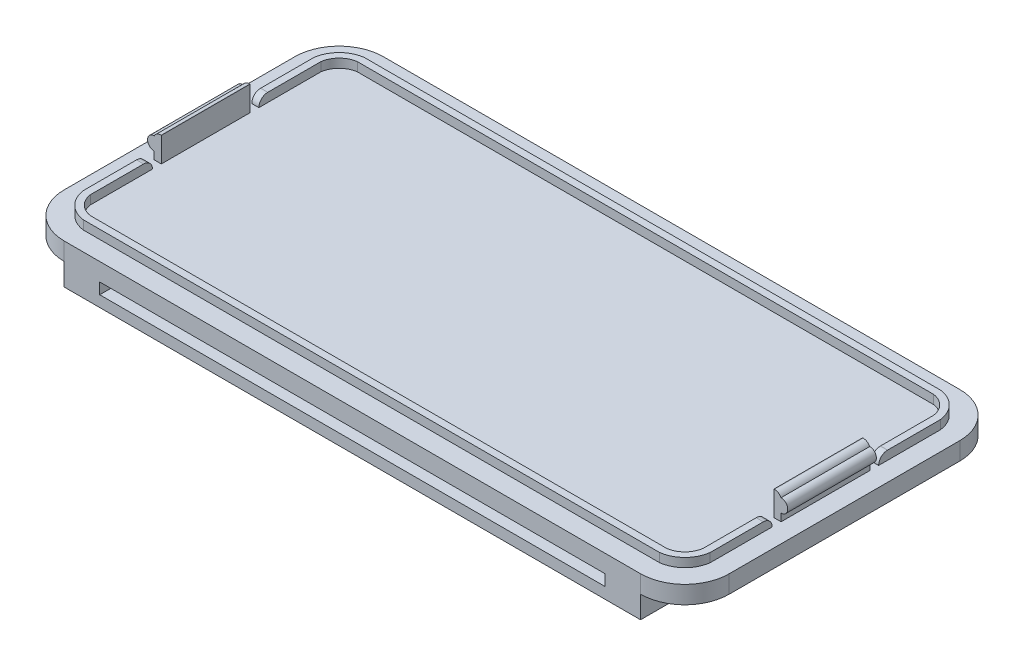
from build123d import *

# Parameters (mm, degrees)
EXTRUDE_2_DEPTH     = 2
EXTRUDE_4_DEPTH     = 1
SKETCH_7_W          = 0.8
SKETCH_7_H          = 10
EXTRUDE_8_DEPTH     = 2.8
SKETCH_8_R          = 0.75
EXTRUDE_9_DEPTH     = 10
FILLET_1_R          = 0.85
SKETCH_11_W         = 1
SKETCH_11_H         = 1
CUT_EXTRUDE_1_DEPTH = 1.2
FILLET_2_R          = 1
SKETCH3_W           = 1.794871795
SKETCH3_H           = 10.256410256
CUT_EXTRUDE1_DEPTH  = 1
SKETCH_13_W         = 0.8
SKETCH_13_H         = 10
EXTRUDE_10_DEPTH    = 1.8
SKETCH_14_R         = 0.75
EXTRUDE_11_DEPTH    = 10
FILLET_3_R          = 0.85
SKETCH_15_W         = 0.8
SKETCH_15_H         = 1
CUT_EXTRUDE_3_DEPTH = 1
FILLET_4_R          = 1
SKETCH5_W           = 4
SKETCH5_H           = 8
BOSS_EXTRUDE1_DEPTH = 2.5
BOSS_EXTRUDE2_REACH = 70.579
SKETCH7_W           = 8
SKETCH7_H           = 1.25


# Some blends are built 0.0001 mm under size
with BuildPart() as part:
    # case 2 → 凸台-拉伸2 (new body)
    with BuildSketch(Plane(origin=(0, 0, 0), x_dir=(1, 0, 0), z_dir=(0, 1, 0))):
        with BuildLine():
            Line((-34.042196447, 18), (30.957803553, 18))
            ThreePointArc((30.957803553, 18), (34.493337459, 16.535533906), (35.957803553, 13))
            Line((35.957803553, 13), (35.957803553, -13))
            ThreePointArc((35.957803553, -13), (34.493337459, -16.535533906), (30.957803553, -18))
            Line((30.957803553, -18), (-34.042196447, -18))
            ThreePointArc((-34.042196447, -18), (-37.577730353, -16.535533906), (-39.042196447, -13))
            Line((-39.042196447, -13), (-39.042196447, 13))
            ThreePointArc((-39.042196447, 13), (-37.577730353, 16.535533906), (-34.042196447, 18))
        make_face()
    extrude(amount=EXTRUDE_2_DEPTH)

    # 草图3 → 凸台-拉伸4 (add)
    with BuildSketch(Plane(origin=(0, 2, 0), x_dir=(1, 0, 0), z_dir=(0, 1, 0))):
        with BuildLine():
            Line((-36.892196447, 13), (-36.892196447, -13))
            ThreePointArc((-36.892196447, -13), (-35.952846076, -14.910649629), (-34.042196447, -15.85))
            Line((-34.042196447, -15.85), (30.957803553, -15.85))
            ThreePointArc((30.957803553, -15.85), (32.868453181, -14.910649629), (33.807803553, -13))
            Line((33.807803553, -13), (33.807803553, 13))
            ThreePointArc((33.807803553, 13), (32.868453181, 14.910649629), (30.957803553, 15.85))
            Line((30.957803553, 15.85), (-34.042196447, 15.85))
            ThreePointArc((-34.042196447, 15.85), (-35.952846076, 14.910649629), (-36.892196447, 13))
        make_face()
        with BuildLine():
            Line((-34.042196447, -15.05), (30.957803553, -15.05))
            ThreePointArc((30.957803553, -15.05), (32.327315928, -14.369512375), (33.007803553, -13))
            Line((33.007803553, -13), (33.007803553, 13))
            ThreePointArc((33.007803553, 13), (32.327315928, 14.369512375), (30.957803553, 15.05))
            Line((30.957803553, 15.05), (-34.042196447, 15.05))
            ThreePointArc((-34.042196447, 15.05), (-35.411708823, 14.369512375), (-36.092196447, 13))
            Line((-36.092196447, 13), (-36.092196447, -13))
            ThreePointArc((-36.092196447, -13), (-35.411708823, -14.369512375), (-34.042196447, -15.05))
        make_face(mode=Mode.SUBTRACT)
    extrude(amount=EXTRUDE_4_DEPTH)

    # 草图7 → 凸台-拉伸8 (add)
    with BuildSketch(Plane(origin=(0, 2, 0), x_dir=(1, 0, 0), z_dir=(0, 1, 0))):
        with Locations((-36.492196447, 0)):
            Rectangle(SKETCH_7_W, SKETCH_7_H)
    extrude(amount=EXTRUDE_8_DEPTH)

    # 草图8 → 凸台-拉伸9 (add)
    with BuildSketch(Plane.XY.offset(5)):
        with Locations((-36.892196447, 3.6)):
            Circle(SKETCH_8_R)
    extrude(amount=-EXTRUDE_9_DEPTH)

    # 圆角1
    # the kernel refuses this fillet: 0.85 mm, written as the material it takes off along each edge
    with BuildSketch(Plane(origin=(-36.892196447, 4.8, 6.875), x_dir=(0, -1, 0), z_dir=(0, 0, -1))) as fillet_1_piece_1:
        with BuildLine():
            CenterArc((0.85, -0.75), FILLET_1_R, 118.072486936, 61.927513064)
            Line((0, -0.75), (-0.017, -0.75))
            Line((-0.017, -0.75), (-0.017, 0))
            Line((-0.017, 0), (0, 0.017))
            ThreePointArc((0, 0.017), (0.225, 0.017), (0.442, 0.015))
            Line((0.442, 0.015), (0.45, 0))
        make_face()
    extrude(amount=13.75, mode=Mode.SUBTRACT)

    # 草图11 → 切除-拉伸1 (cut)
    with BuildSketch(Plane.ZY.offset(36.892196447)):
        with Locations((5.5, 2.5)):
            Rectangle(SKETCH_11_W, SKETCH_11_H)
        with Locations((-5.5, 2.5)):
            Rectangle(SKETCH_11_W, SKETCH_11_H)
    extrude(amount=-CUT_EXTRUDE_1_DEPTH, mode=Mode.SUBTRACT)

    # 圆角2
    fillet_2_edges = [part.edges().sort_by_distance(p)[0] for p in [
        (-36.492196447, 3, 6),
        (-36.492196447, 3, -6),
    ]]
    fillet(fillet_2_edges, radius=FILLET_2_R - 0.0001)  # a hair under: the kernel refuses the full size

    # Sketch3 → Cut-Extrude1 (cut)
    # profile 1 of 9: a face of its own
    with BuildSketch(Plane.XZ):
        with BuildLine():
            Line((-34.346153846, 5.5), (-32.342948718, 5.5))
            add(Edge.make_bspline(
                [(-32.342948718, 5.5), (-32.212061894, 5.499414123), (-31.959553774, 5.498283843), (-31.59541629, 5.484577693), (-31.259481633, 5.460015438), (-30.951826982, 5.429660375), (-30.672578836, 5.387103759), (-30.421387495, 5.33831593), (-30.198200829, 5.278878154), (-30.000502078, 5.208326339), (-29.823073834, 5.125148505), (-29.65516949, 5.036558175), (-29.500583701, 4.93082874), (-29.351514057, 4.81935527), (-29.216483126, 4.691488748), (-29.08706687, 4.555738875), (-28.96874642, 4.406721924), (-28.860973524, 4.246241705), (-28.7632069, 4.077263206), (-28.677791437, 3.899484343), (-28.608507197, 3.7126238), (-28.550386335, 3.517890353), (-28.503703092, 3.315292488), (-28.47262924, 3.10358421), (-28.451522316, 2.884243747), (-28.449659922, 2.73496049), (-28.448717949, 2.659455128)],
                knots=[0, 0, 0, 0, 1.698747864, 3.27724071, 4.728299578, 6.070144658, 7.288476769, 8.393259625, 9.389771311, 10.283485332, 11.113357557, 11.931608583, 12.74405601, 13.541433047, 14.344816069, 15.154114104, 15.974336324, 16.810834471, 17.661136416, 18.50621059, 19.367396281, 20.244825668, 21.142564693, 22.063065223, 23.020325768, 24, 24, 24, 24], degree=3))
            add(Edge.make_bspline(
                [(-28.448717949, 2.659455128), (-28.450080866, 2.575925345), (-28.452759164, 2.411779055), (-28.479015125, 2.171160733), (-28.523868602, 1.941752949), (-28.58248975, 1.721621064), (-28.664232772, 1.514386738), (-28.757620336, 1.315105294), (-28.872516661, 1.129363974), (-29.003804081, 0.954839376), (-29.147184921, 0.790112534), (-29.306063036, 0.639939624), (-29.477410142, 0.503296922), (-29.660234371, 0.378752402), (-29.8552221, 0.266557297), (-30.062232636, 0.165661021), (-30.282679565, 0.079290548), (-30.436192173, 0.03411949), (-30.514022436, 0.011217949)],
                knots=[0, 0, 0, 0, 1.102006807, 2.165578795, 3.188629044, 4.184801286, 5.166646146, 6.124351954, 7.085497154, 8.042432466, 9.003981491, 9.963833307, 10.922997304, 11.89326795, 12.880200226, 13.889073926, 14.929769137, 16, 16, 16, 16], degree=3))
            add(Edge.make_bspline(
                [(-30.514022436, 0.011217949), (-30.565285924, -0.00153649), (-30.676339148, -0.029166712), (-30.86010173, -0.057218322), (-31.071868812, -0.083010053), (-31.312325176, -0.105174923), (-31.581609449, -0.12024187), (-31.879460895, -0.132008485), (-32.206014495, -0.14056403), (-32.433086955, -0.140867618), (-32.551282051, -0.141025641)],
                knots=[0, 0, 0, 0, 0.618981996, 1.340914327, 2.176866532, 3.120127938, 4.170906482, 5.338178032, 6.614476169, 8, 8, 8, 8], degree=3))
            Line((-32.551282051, -0.141025641), (-32.551282051, -4.5))
            Line((-32.551282051, -4.5), (-34.346153846, -4.5))
            Line((-34.346153846, -4.5), (-34.346153846, 5.5))
        make_face()
        with BuildLine():
            Line((-32.551282051, 1.653846154), (-31.916266026, 1.653846154))
            add(Edge.make_bspline(
                [(-31.916266026, 1.653846154), (-31.800714834, 1.654578838), (-31.588098926, 1.655926988), (-31.297740676, 1.675422019), (-31.064403201, 1.705194869), (-30.880062263, 1.747896022), (-30.734507633, 1.812700675), (-30.608975876, 1.887667455), (-30.501304084, 1.982460891), (-30.40807616, 2.090778611), (-30.333543244, 2.215241101), (-30.281858549, 2.353821729), (-30.248285187, 2.50360877), (-30.245184375, 2.607850636), (-30.243589744, 2.661458333)],
                knots=[0, 0, 0, 0, 1.8619151, 3.425951444, 4.686033666, 5.651700536, 6.461346321, 7.243864085, 7.999046032, 8.762387399, 9.539336099, 10.322741239, 11.137448474, 12, 12, 12, 12], degree=3))
            add(Edge.make_bspline(
                [(-30.243589744, 2.661458333), (-30.245167972, 2.708294681), (-30.248230115, 2.799168456), (-30.270725453, 2.930321853), (-30.306576549, 3.052583875), (-30.35852341, 3.164677657), (-30.425678401, 3.266412733), (-30.507553924, 3.357749027), (-30.603099357, 3.440642582), (-30.676866017, 3.484519408), (-30.714342949, 3.506810897)],
                knots=[0, 0, 0, 0, 1.102301479, 2.1387299, 3.123554645, 4.094223062, 5.036071848, 5.982632524, 6.975082478, 8, 8, 8, 8], degree=3))
            add(Edge.make_bspline(
                [(-30.714342949, 3.506810897), (-30.746088073, 3.522865317), (-30.813299006, 3.556855813), (-30.927765742, 3.59637225), (-31.059858607, 3.629708718), (-31.210469377, 3.657377665), (-31.378997222, 3.678851641), (-31.565412075, 3.69527386), (-31.769988262, 3.701877875), (-31.912258759, 3.704014878), (-31.986378205, 3.705128205)],
                knots=[0, 0, 0, 0, 0.656809284, 1.390599849, 2.23162475, 3.173112763, 4.218524733, 5.370385145, 6.63003504, 8, 8, 8, 8], degree=3))
            Line((-31.986378205, 3.705128205), (-32.551282051, 3.705128205))
            Line((-32.551282051, 3.705128205), (-32.551282051, 1.653846154))
        make_face(mode=Mode.SUBTRACT)
    # profile 2 of 9: a face of its own
    with BuildSketch(Plane.XZ):
        with BuildLine():
            Line((-19.608573718, -1.294871795), (-25.371794872, -1.294871795))
            add(Edge.make_bspline(
                [(-25.371794872, -1.294871795), (-25.360044129, -1.361837155), (-25.336952993, -1.493429371), (-25.28680977, -1.684578484), (-25.222819497, -1.864714181), (-25.146131184, -2.03407726), (-25.058037797, -2.193563078), (-24.955284158, -2.342423583), (-24.839173605, -2.480527291), (-24.710377458, -2.60727399), (-24.571042515, -2.72084178), (-24.421844499, -2.820334343), (-24.262629446, -2.901912158), (-24.095222698, -2.970673791), (-23.91837334, -3.025139971), (-23.731821096, -3.062704259), (-23.536060486, -3.084893621), (-23.402702378, -3.088103059), (-23.334535256, -3.08974359)],
                knots=[0, 0, 0, 0, 1.091296461, 2.144483647, 3.168565212, 4.157007626, 5.126487748, 6.090021542, 7.05641414, 8.019231907, 8.98705074, 9.938580405, 10.892824166, 11.854447369, 12.841318655, 13.858982407, 14.905600794, 16, 16, 16, 16], degree=3))
            add(Edge.make_bspline(
                [(-23.334535256, -3.08974359), (-23.252252913, -3.087571256), (-23.090214747, -3.083293292), (-22.852827627, -3.045354104), (-22.623239702, -2.988048629), (-22.403623683, -2.902830576), (-22.191435664, -2.796749081), (-21.99016891, -2.664584591), (-21.796339653, -2.510199384), (-21.678080964, -2.391199325), (-21.617788462, -2.330528846)],
                knots=[0, 0, 0, 0, 1.021034703, 2.010718019, 2.977989445, 3.954245119, 4.929443971, 5.918328161, 6.938689359, 8, 8, 8, 8], degree=3))
            Line((-21.617788462, -2.330528846), (-20.115384615, -3.045673077))
            add(Edge.make_bspline(
                [(-20.115384615, -3.045673077), (-20.162686924, -3.111037607), (-20.256414708, -3.24055502), (-20.40942217, -3.42281947), (-20.5690952, -3.592879596), (-20.735552881, -3.749616887), (-20.909006324, -3.892584703), (-21.088973023, -4.02352465), (-21.278083117, -4.138921045), (-21.472555384, -4.244356693), (-21.676409927, -4.334746186), (-21.889082589, -4.411827154), (-22.109672582, -4.481507694), (-22.340965482, -4.534600448), (-22.581035315, -4.576628239), (-22.830456374, -4.606473539), (-23.089195787, -4.62490755), (-23.265059458, -4.62709288), (-23.354567308, -4.628205128)],
                knots=[0, 0, 0, 0, 1.028154879, 2.037251081, 3.030720504, 4.000128189, 4.949298328, 5.894184978, 6.834267904, 7.770992897, 8.712077017, 9.673380525, 10.653304757, 11.658697181, 12.695551717, 13.758623199, 14.859225354, 16, 16, 16, 16], degree=3))
            add(Edge.make_bspline(
                [(-23.354567308, -4.628205128), (-23.492273665, -4.62539771), (-23.761963628, -4.619899543), (-24.156433952, -4.568868685), (-24.531071349, -4.484254021), (-24.886933665, -4.369233381), (-25.222482625, -4.217370103), (-25.537884295, -4.031628717), (-25.836289987, -3.815570256), (-26.108581741, -3.564660229), (-26.356647563, -3.291559581), (-26.574533157, -2.998268135), (-26.75685672, -2.686835006), (-26.906584497, -2.359321324), (-27.022958126, -2.014888783), (-27.106856762, -1.653387079), (-27.158287632, -1.274988873), (-27.163842421, -1.017257454), (-27.166666667, -0.886217949)],
                knots=[0, 0, 0, 0, 1.103565453, 2.161269334, 3.182010356, 4.179077853, 5.15417608, 6.128274628, 7.109042802, 8.101804412, 9.090965879, 10.063106201, 11.02526161, 11.978650795, 12.945248442, 13.93468508, 14.949922959, 16, 16, 16, 16], degree=3))
            add(Edge.make_bspline(
                [(-27.166666667, -0.886217949), (-27.163814625, -0.751848561), (-27.15820336, -0.487482826), (-27.107299582, -0.100347232), (-27.022726175, 0.269032487), (-26.906012127, 0.621165006), (-26.75855574, 0.957151645), (-26.573912422, 1.274052922), (-26.356755688, 1.572972117), (-26.109583518, 1.852510854), (-25.836138252, 2.104825104), (-25.545576822, 2.329687524), (-25.234634472, 2.517057818), (-24.90682823, 2.668452899), (-24.564254861, 2.791457581), (-24.202954696, 2.873306924), (-23.82567668, 2.928263858), (-23.567777735, 2.933325049), (-23.436698718, 2.935897436)],
                knots=[0, 0, 0, 0, 1.079208495, 2.12329425, 3.130605359, 4.119693003, 5.099659317, 6.073216462, 7.060498243, 8.06384408, 9.066070512, 10.045757761, 11.010926815, 11.975797609, 12.942977511, 13.929384301, 14.947594487, 16, 16, 16, 16], degree=3))
            add(Edge.make_bspline(
                [(-23.436698718, 2.935897436), (-23.298332654, 2.933046463), (-23.026665148, 2.92744887), (-22.62944746, 2.876832371), (-22.252322515, 2.791701737), (-21.893683551, 2.677675659), (-21.558110534, 2.521976156), (-21.238229907, 2.34080557), (-20.941714222, 2.120076842), (-20.665402937, 1.870394688), (-20.415975531, 1.593380991), (-20.197948342, 1.292459272), (-20.012434038, 0.970566352), (-19.862072854, 0.626396885), (-19.745818719, 0.260984102), (-19.661842419, -0.125197436), (-19.610803845, -0.533616578), (-19.605352417, -0.813284573), (-19.602564103, -0.956330128)],
                knots=[0, 0, 0, 0, 1.080001299, 2.120471247, 3.119684163, 4.095710327, 5.052285597, 6.002875087, 6.961153713, 7.931888285, 8.906493152, 9.865905668, 10.82813294, 11.801621613, 12.7925306, 13.817193356, 14.883530496, 16, 16, 16, 16], degree=3))
            Line((-19.602564103, -0.956330128), (-19.608573718, -1.294871795))
        make_face()
        with BuildLine():
            add(Edge.make_bspline(
                [(-21.397435897, 0.115384615), (-21.431306226, 0.206786912), (-21.498649262, 0.388518488), (-21.650774379, 0.639263719), (-21.852639541, 0.856419274), (-22.087423207, 1.048668808), (-22.355678245, 1.204710539), (-22.648951472, 1.31768982), (-22.963535969, 1.385433614), (-23.179953151, 1.393378771), (-23.290464744, 1.397435897)],
                knots=[0, 0, 0, 0, 0.954238005, 1.897273737, 2.851915805, 3.847685534, 4.862635127, 5.880135777, 6.917509367, 8, 8, 8, 8], degree=3))
            add(Edge.make_bspline(
                [(-23.290464744, 1.397435897), (-23.411161396, 1.393538533), (-23.64709822, 1.385919998), (-23.987421025, 1.304894075), (-24.308439011, 1.183965305), (-24.497693022, 1.059285175), (-24.592548077, 0.996794872)],
                knots=[0, 0, 0, 0, 1.044195649, 2.041185066, 3.018232172, 4, 4, 4, 4], degree=3))
            add(Edge.make_bspline(
                [(-24.592548077, 0.996794872), (-24.651730547, 0.949200888), (-24.777904548, 0.847732947), (-24.941767086, 0.645314038), (-25.10317305, 0.40023018), (-25.19494124, 0.214071675), (-25.243589744, 0.115384615)],
                knots=[0, 0, 0, 0, 0.82159062, 1.751589201, 2.808063854, 4, 4, 4, 4], degree=3))
            Line((-25.243589744, 0.115384615), (-21.397435897, 0.115384615))
        make_face(mode=Mode.SUBTRACT)
    # profile 3 of 9: a face of its own
    with BuildSketch(Plane.XZ):
        with BuildLine():
            Line((-12.551282051, 2.807692308), (-10.756410256, 2.807692308))
            Line((-10.756410256, 2.807692308), (-10.756410256, -4.5))
            Line((-10.756410256, -4.5), (-12.551282051, -4.5))
            Line((-12.551282051, -4.5), (-12.551282051, -3.702724359))
            add(Edge.make_bspline(
                [(-12.551282051, -3.702724359), (-12.640217287, -3.780330319), (-12.812823018, -3.930948161), (-13.084793797, -4.12637864), (-13.357559306, -4.287583528), (-13.632430191, -4.41597443), (-13.913631102, -4.510777897), (-14.203186573, -4.579417821), (-14.50526651, -4.619896463), (-14.71061629, -4.625406724), (-14.814903846, -4.628205128)],
                knots=[0, 0, 0, 0, 1.129196829, 2.191548051, 3.199897424, 4.157751732, 5.089409408, 6.034969131, 7.002052659, 8, 8, 8, 8], degree=3))
            add(Edge.make_bspline(
                [(-14.814903846, -4.628205128), (-14.931971264, -4.625571477), (-15.163303116, -4.620367234), (-15.502756926, -4.565584179), (-15.830533327, -4.481726502), (-16.146366257, -4.363057407), (-16.449681084, -4.209285525), (-16.742799088, -4.024422978), (-17.020695333, -3.801979986), (-17.28568321, -3.55158109), (-17.528304521, -3.276140523), (-17.740406361, -2.979481362), (-17.919192449, -2.665811062), (-18.065662324, -2.336169585), (-18.180879796, -1.990798869), (-18.263013366, -1.628603503), (-18.311472267, -1.24945413), (-18.317470113, -0.991192425), (-18.320512821, -0.860176282)],
                knots=[0, 0, 0, 0, 0.980476535, 1.937477201, 2.874147792, 3.812856188, 4.758993464, 5.720109578, 6.712210464, 7.737600662, 8.772720504, 9.783789959, 10.789002326, 11.793715968, 12.802552247, 13.835794126, 14.902098527, 16, 16, 16, 16], degree=3))
            add(Edge.make_bspline(
                [(-18.320512821, -0.860176282), (-18.317319488, -0.724508894), (-18.311055411, -0.458382195), (-18.265234059, -0.067853919), (-18.184616162, 0.303322052), (-18.074687865, 0.655659847), (-17.933284198, 0.989220339), (-17.761063981, 1.304550006), (-17.555684317, 1.600824627), (-17.319020664, 1.8730014), (-17.063482045, 2.122464558), (-16.790100899, 2.339642021), (-16.503152308, 2.524144381), (-16.202331338, 2.674769906), (-15.88768095, 2.791165689), (-15.560443377, 2.87626051), (-15.219165916, 2.927320392), (-14.986684944, 2.933014678), (-14.868990385, 2.935897436)],
                knots=[0, 0, 0, 0, 1.136281865, 2.228943489, 3.287578264, 4.313574083, 5.316051562, 6.317280042, 7.318008486, 8.329309503, 9.333984563, 10.305318864, 11.248632312, 12.186624717, 13.117503092, 14.05354244, 15.014596925, 16, 16, 16, 16], degree=3))
            add(Edge.make_bspline(
                [(-14.868990385, 2.935897436), (-14.759967087, 2.933632454), (-14.544249279, 2.929150872), (-14.227175182, 2.880489461), (-13.919659039, 2.806892533), (-13.623378367, 2.702030158), (-13.335902973, 2.569620077), (-13.062177614, 2.403700375), (-12.796214302, 2.211244585), (-12.633934865, 2.060932535), (-12.551282051, 1.984375)],
                knots=[0, 0, 0, 0, 1.017011718, 2.012299608, 2.98747302, 3.965332399, 4.941441765, 5.936729654, 6.94912688, 8, 8, 8, 8], degree=3))
            Line((-12.551282051, 1.984375), (-12.551282051, 2.807692308))
        make_face()
        with BuildLine():
            add(Edge.make_bspline(
                [(-14.492387821, 1.269230769), (-14.563908171, 1.267036278), (-14.704083387, 1.262735219), (-14.910230225, 1.236864046), (-15.107244762, 1.191277886), (-15.293721904, 1.123934125), (-15.472440845, 1.041899611), (-15.640687712, 0.939152733), (-15.799851096, 0.817708107), (-15.94899494, 0.680505905), (-16.084961529, 0.5296956), (-16.202172664, 0.365128882), (-16.301783193, 0.191239889), (-16.386027812, 0.007505796), (-16.446327845, -0.188247538), (-16.494085447, -0.393471754), (-16.518868551, -0.609843428), (-16.523360946, -0.757294026), (-16.525641026, -0.83213141)],
                knots=[0, 0, 0, 0, 1.04836806, 2.054732945, 3.03993516, 4.00574415, 4.955904794, 5.917688631, 6.888591924, 7.88601754, 8.884115178, 9.859153345, 10.841239365, 11.818093293, 12.814750328, 13.83810466, 14.90274714, 16, 16, 16, 16], degree=3))
            add(Edge.make_bspline(
                [(-16.525641026, -0.83213141), (-16.523395775, -0.907647613), (-16.518971534, -1.056451413), (-16.493684728, -1.27464826), (-16.447645642, -1.482870319), (-16.380476352, -1.679434257), (-16.298447068, -1.866992373), (-16.198598981, -2.044679067), (-16.075953096, -2.209352616), (-15.939867317, -2.364909751), (-15.787663811, -2.503816234), (-15.627599816, -2.627152439), (-15.457488986, -2.730347762), (-15.279176903, -2.813750875), (-15.093263774, -2.881717402), (-14.897418811, -2.926730636), (-14.693560564, -2.955506745), (-14.554585013, -2.959514006), (-14.484375, -2.961538462)],
                knots=[0, 0, 0, 0, 1.099136573, 2.165835871, 3.191374663, 4.196217796, 5.183857741, 6.167377911, 7.154730987, 8.166690795, 9.170734848, 10.148332609, 11.103258353, 12.059567475, 13.009337315, 13.978056681, 14.978520572, 16, 16, 16, 16], degree=3))
            add(Edge.make_bspline(
                [(-14.484375, -2.961538462), (-14.4115225, -2.959331668), (-14.268691995, -2.955005152), (-14.059181975, -2.929370081), (-13.859520827, -2.883616776), (-13.670539249, -2.815887456), (-13.489350726, -2.734441788), (-13.317590322, -2.633702663), (-13.157121897, -2.512536719), (-13.007132751, -2.374094205), (-12.869696613, -2.222052443), (-12.75086454, -2.055327693), (-12.647357458, -1.879252272), (-12.565953899, -1.689663113), (-12.501308058, -1.489877143), (-12.454926159, -1.278654447), (-12.429697094, -1.055767301), (-12.425311548, -0.903638139), (-12.423076923, -0.826121795)],
                knots=[0, 0, 0, 0, 1.050008698, 2.058587853, 3.036635738, 3.995319155, 4.947022481, 5.895997462, 6.858296291, 7.838991643, 8.833936038, 9.806048392, 10.784806122, 11.771666913, 12.772873988, 13.80724452, 14.882696879, 16, 16, 16, 16], degree=3))
            add(Edge.make_bspline(
                [(-12.423076923, -0.826121795), (-12.42528378, -0.749938696), (-12.429594413, -0.601130972), (-12.455034965, -0.382897604), (-12.50174615, -0.175822357), (-12.565061473, 0.020475401), (-12.647913225, 0.205546837), (-12.751498624, 0.37733995), (-12.869027177, 0.541806728), (-13.007984932, 0.689741001), (-13.157161552, 0.827181084), (-13.319989926, 0.944682882), (-13.491340075, 1.045949192), (-13.672264778, 1.129092738), (-13.864439315, 1.190040109), (-14.064441671, 1.237229428), (-14.275392296, 1.262719691), (-14.418875606, 1.267024992), (-14.492387821, 1.269230769)],
                knots=[0, 0, 0, 0, 1.106611376, 2.161533483, 3.185006901, 4.184773755, 5.152708835, 6.122342771, 7.094156588, 8.082475533, 9.064254463, 10.03606828, 10.992420271, 11.951521816, 12.920622147, 13.915721683, 14.932141191, 16, 16, 16, 16], degree=3))
        make_face(mode=Mode.SUBTRACT)
    # profile 4 of 9: a face of its own
    with BuildSketch(Plane.XZ):
        Polygon((-8.961538462, 5.756410256), (-7.166666667, 5.756410256), (-7.166666667, -0.225160256), (-4.374198718, 2.807692308), (-2.156650641, 2.807692308), (-5.363782051, -0.67588141), (-1.697916667, -4.5), (-3.957532051, -4.5), (-7.166666667, -1.152644231), (-7.166666667, -4.5), (-8.961538462, -4.5), align=None)
    # profile 5 of 9: a face of its own
    with BuildSketch(Plane.XZ):
        with BuildLine():
            Line((-0.628205128, 5.5), (1.375, 5.5))
            add(Edge.make_bspline(
                [(1.375, 5.5), (1.505886824, 5.499414123), (1.758394944, 5.498283843), (2.122532428, 5.484577693), (2.458467085, 5.460015438), (2.766121736, 5.429660375), (3.045369882, 5.387103759), (3.296561223, 5.33831593), (3.519747889, 5.278878154), (3.71744664, 5.208326339), (3.894874884, 5.125148505), (4.062779228, 5.036558175), (4.217365017, 4.93082874), (4.366434661, 4.81935527), (4.501465592, 4.691488748), (4.630881848, 4.555738875), (4.749202298, 4.406721924), (4.856975194, 4.246241705), (4.954741818, 4.077263206), (5.04015728, 3.899484343), (5.10944152, 3.7126238), (5.167562383, 3.517890353), (5.214245625, 3.315292488), (5.245319478, 3.10358421), (5.266426402, 2.884243747), (5.268288796, 2.73496049), (5.269230769, 2.659455128)],
                knots=[0, 0, 0, 0, 1.698747864, 3.27724071, 4.728299578, 6.070144658, 7.288476769, 8.393259625, 9.389771311, 10.283485332, 11.113357557, 11.931608583, 12.74405601, 13.541433047, 14.344816069, 15.154114104, 15.974336324, 16.810834471, 17.661136416, 18.50621059, 19.367396281, 20.244825668, 21.142564693, 22.063065223, 23.020325768, 24, 24, 24, 24], degree=3))
            add(Edge.make_bspline(
                [(5.269230769, 2.659455128), (5.267867852, 2.575925345), (5.265189553, 2.411779055), (5.238933593, 2.171160733), (5.194080116, 1.941752949), (5.135458968, 1.721621064), (5.053715946, 1.514386738), (4.960328382, 1.315105294), (4.845432057, 1.129363974), (4.714144637, 0.954839376), (4.570763797, 0.790112534), (4.411885682, 0.639939624), (4.240538576, 0.503296922), (4.057714347, 0.378752402), (3.862726618, 0.266557297), (3.655716082, 0.165661021), (3.435269153, 0.079290548), (3.281756545, 0.03411949), (3.203926282, 0.011217949)],
                knots=[0, 0, 0, 0, 1.102006807, 2.165578795, 3.188629044, 4.184801286, 5.166646146, 6.124351954, 7.085497154, 8.042432466, 9.003981491, 9.963833307, 10.922997304, 11.89326795, 12.880200226, 13.889073926, 14.929769137, 16, 16, 16, 16], degree=3))
            add(Edge.make_bspline(
                [(3.203926282, 0.011217949), (3.152662794, -0.00153649), (3.04160957, -0.029166712), (2.857846988, -0.057218322), (2.646079906, -0.083010053), (2.405623542, -0.105174923), (2.136339269, -0.12024187), (1.838487823, -0.132008485), (1.511934223, -0.14056403), (1.284861763, -0.140867618), (1.166666667, -0.141025641)],
                knots=[0, 0, 0, 0, 0.618981996, 1.340914327, 2.176866532, 3.120127938, 4.170906482, 5.338178032, 6.614476169, 8, 8, 8, 8], degree=3))
            Line((1.166666667, -0.141025641), (1.166666667, -4.5))
            Line((1.166666667, -4.5), (-0.628205128, -4.5))
            Line((-0.628205128, -4.5), (-0.628205128, 5.5))
        make_face()
        with BuildLine():
            Line((1.166666667, 1.653846154), (1.801682692, 1.653846154))
            add(Edge.make_bspline(
                [(1.801682692, 1.653846154), (1.917233884, 1.654578838), (2.129849792, 1.655926988), (2.420208042, 1.675422019), (2.653545517, 1.705194869), (2.837886455, 1.747896022), (2.983441085, 1.812700675), (3.108972842, 1.887667455), (3.216644634, 1.982460891), (3.309872558, 2.090778611), (3.384405474, 2.215241101), (3.436090169, 2.353821729), (3.469663531, 2.50360877), (3.472764343, 2.607850636), (3.474358974, 2.661458333)],
                knots=[0, 0, 0, 0, 1.8619151, 3.425951444, 4.686033666, 5.651700536, 6.461346321, 7.243864085, 7.999046032, 8.762387399, 9.539336099, 10.322741239, 11.137448474, 12, 12, 12, 12], degree=3))
            add(Edge.make_bspline(
                [(3.474358974, 2.661458333), (3.472780746, 2.708294681), (3.469718603, 2.799168456), (3.447223265, 2.930321853), (3.411372169, 3.052583875), (3.359425308, 3.164677657), (3.292270317, 3.266412733), (3.210394794, 3.357749027), (3.114849361, 3.440642582), (3.041082701, 3.484519408), (3.003605769, 3.506810897)],
                knots=[0, 0, 0, 0, 1.102301479, 2.1387299, 3.123554645, 4.094223062, 5.036071848, 5.982632524, 6.975082478, 8, 8, 8, 8], degree=3))
            add(Edge.make_bspline(
                [(3.003605769, 3.506810897), (2.971860645, 3.522865317), (2.904649712, 3.556855813), (2.790182976, 3.59637225), (2.658090111, 3.629708718), (2.507479341, 3.657377665), (2.338951496, 3.678851641), (2.152536643, 3.69527386), (1.947960456, 3.701877875), (1.805689959, 3.704014878), (1.731570513, 3.705128205)],
                knots=[0, 0, 0, 0, 0.656809284, 1.390599849, 2.23162475, 3.173112763, 4.218524733, 5.370385145, 6.63003504, 8, 8, 8, 8], degree=3))
            Line((1.731570513, 3.705128205), (1.166666667, 3.705128205))
            Line((1.166666667, 3.705128205), (1.166666667, 1.653846154))
        make_face(mode=Mode.SUBTRACT)
    # profile 6 of 9: a face of its own
    with BuildSketch(Plane.XZ):
        with BuildLine():
            Line((6.807692308, 2.807692308), (8.602564103, 2.807692308))
            Line((8.602564103, 2.807692308), (8.602564103, -0.699919872))
            add(Edge.make_bspline(
                [(8.602564103, -0.699919872), (8.602723488, -0.782059682), (8.603029388, -0.939706038), (8.611541581, -1.166117068), (8.62348587, -1.373159588), (8.638391535, -1.561077737), (8.660639195, -1.729419511), (8.686323181, -1.877863541), (8.715440535, -2.007479383), (8.76278903, -2.15195352), (8.836866605, -2.310052677), (8.948736856, -2.477893498), (9.084244359, -2.623026732), (9.241558317, -2.746740361), (9.422285292, -2.844229418), (9.623935339, -2.910296264), (9.843971289, -2.954700053), (9.997226, -2.959198917), (10.076923077, -2.961538462)],
                knots=[0, 0, 0, 0, 1.267339619, 2.432334223, 3.495366327, 4.467371443, 5.340232306, 6.114347373, 6.791623365, 7.387877112, 8.457231658, 9.474542289, 10.487879852, 11.508108106, 12.54995813, 13.638205937, 14.771795776, 16, 16, 16, 16], degree=3))
            add(Edge.make_bspline(
                [(10.076923077, -2.961538462), (10.15654943, -2.958868202), (10.310200482, -2.953715534), (10.531700417, -2.913533658), (10.733825429, -2.844680674), (10.91865147, -2.751289728), (11.08072801, -2.626301853), (11.221841424, -2.477369934), (11.340655608, -2.302091514), (11.397751302, -2.171338836), (11.427083333, -2.104166667)],
                knots=[0, 0, 0, 0, 1.116871431, 2.155171802, 3.144773418, 4.104381479, 5.046960687, 6.001340237, 6.973219418, 8, 8, 8, 8], degree=3))
            add(Edge.make_bspline(
                [(11.427083333, -2.104166667), (11.437847203, -2.074328187), (11.461607205, -2.008463184), (11.482754076, -1.89483699), (11.505514407, -1.760833291), (11.523518637, -1.603721206), (11.533706066, -1.424473744), (11.544620853, -1.222864992), (11.550183224, -0.99909574), (11.55090456, -0.842149572), (11.551282051, -0.760016026)],
                knots=[0, 0, 0, 0, 0.56094539, 1.238222264, 2.041156151, 2.969685991, 4.036367568, 5.220421584, 6.545382566, 8, 8, 8, 8], degree=3))
            Line((11.551282051, -0.760016026), (11.551282051, 2.807692308))
            Line((11.551282051, 2.807692308), (13.346153846, 2.807692308))
            Line((13.346153846, 2.807692308), (13.346153846, -0.263221154))
            add(Edge.make_bspline(
                [(13.346153846, -0.263221154), (13.345843066, -0.415483556), (13.345247206, -0.707416665), (13.328170227, -1.126185223), (13.304602061, -1.506929426), (13.274250797, -1.850697582), (13.230518376, -2.157632359), (13.176834499, -2.427013985), (13.117442991, -2.66062257), (13.062978765, -2.799037271), (13.037660256, -2.86338141)],
                knots=[0, 0, 0, 0, 1.388070971, 2.661352173, 3.82033814, 4.865898334, 5.806910977, 6.645039373, 7.370126333, 8, 8, 8, 8], degree=3))
            add(Edge.make_bspline(
                [(13.037660256, -2.86338141), (13.00520845, -2.932635584), (12.941151372, -3.069337373), (12.830000433, -3.263697042), (12.710173496, -3.447837431), (12.575969148, -3.617424055), (12.430126916, -3.77418049), (12.276769302, -3.921670191), (12.108989876, -4.053887155), (11.931139777, -4.174233696), (11.740737356, -4.281064307), (11.539086728, -4.375734322), (11.324008739, -4.452779482), (11.097368369, -4.518086121), (10.858120955, -4.566788641), (10.606748434, -4.603677085), (10.342975108, -4.622741173), (10.163086586, -4.626353967), (10.070913462, -4.628205128)],
                knots=[0, 0, 0, 0, 0.997311338, 1.968606903, 2.91805772, 3.860812155, 4.785445165, 5.709667791, 6.633356648, 7.568312411, 8.508286151, 9.478643871, 10.470653671, 11.485274776, 12.552984541, 13.653035246, 14.797438149, 16, 16, 16, 16], degree=3))
            add(Edge.make_bspline(
                [(10.070913462, -4.628205128), (9.971340586, -4.627018482), (9.776510234, -4.624696619), (9.491865812, -4.596262887), (9.22059585, -4.559473336), (8.965729062, -4.496924355), (8.723706114, -4.424458232), (8.497305566, -4.331972183), (8.28560229, -4.223234794), (8.088179729, -4.098890722), (7.906569021, -3.957800483), (7.736731851, -3.806062844), (7.58415129, -3.637640644), (7.443846205, -3.457734827), (7.317382479, -3.264689631), (7.204697345, -3.059191468), (7.105695351, -2.840305627), (7.052872876, -2.686897906), (7.026041667, -2.608974359)],
                knots=[0, 0, 0, 0, 1.211240017, 2.369985978, 3.478996442, 4.539426614, 5.559871561, 6.551301256, 7.510778031, 8.453136967, 9.386094087, 10.30661716, 11.221130616, 12.147659962, 13.080758632, 14.026335491, 14.997475882, 16, 16, 16, 16], degree=3))
            add(Edge.make_bspline(
                [(7.026041667, -2.608974359), (7.007736541, -2.548455949), (6.968303033, -2.418085187), (6.925726927, -2.201424197), (6.891673008, -1.951710275), (6.858546433, -1.668697792), (6.835436729, -1.351912277), (6.820331952, -1.001856828), (6.810126121, -0.617846912), (6.808527479, -0.350701513), (6.807692308, -0.211137821)],
                knots=[0, 0, 0, 0, 0.627914866, 1.352675004, 2.190563461, 3.132055958, 4.183353232, 5.345633452, 6.613289997, 8, 8, 8, 8], degree=3))
            Line((6.807692308, -0.211137821), (6.807692308, 2.807692308))
        make_face()
    # profile 7 of 9: a face of its own
    with BuildSketch(Plane.XZ):
        with Locations((15.910256411, 0.628205128)):
            Rectangle(SKETCH3_W, SKETCH3_H)
    # profile 8 of 9: a face of its own
    with BuildSketch(Plane.XZ):
        with BuildLine():
            Line((22.961538462, 1.679887821), (21.863782051, 0.5))
            add(Edge.make_bspline(
                [(21.863782051, 0.5), (21.808965815, 0.560657138), (21.704123119, 0.676671265), (21.543619085, 0.834824449), (21.385505268, 0.966519333), (21.232728109, 1.077148523), (21.082167351, 1.161987888), (20.935074493, 1.223027911), (20.79137896, 1.261777025), (20.696131487, 1.266792952), (20.649839744, 1.269230769)],
                knots=[0, 0, 0, 0, 1.327646587, 2.539285, 3.655602211, 4.666613517, 5.598770349, 6.454635452, 7.248928967, 8, 8, 8, 8], degree=3))
            add(Edge.make_bspline(
                [(20.649839744, 1.269230769), (20.602997149, 1.267803167), (20.513308154, 1.265069754), (20.386736883, 1.241623923), (20.275535554, 1.201034869), (20.181439535, 1.145708205), (20.105841127, 1.077551438), (20.052911157, 0.999581704), (20.017368195, 0.914224046), (20.014361491, 0.853591204), (20.012820513, 0.822516026)],
                knots=[0, 0, 0, 0, 1.295068245, 2.479652818, 3.543291146, 4.55379989, 5.481948265, 6.332409746, 7.145336708, 8, 8, 8, 8], degree=3))
            add(Edge.make_bspline(
                [(20.012820513, 0.822516026), (20.018041488, 0.775423699), (20.028874404, 0.677712593), (20.103281515, 0.564382288), (20.201727496, 0.480780842), (20.315207247, 0.402984895), (20.468888208, 0.316000698), (20.585474485, 0.256440077), (20.649839744, 0.223557692)],
                knots=[0, 0, 0, 0, 0.916701701, 1.902049539, 2.5493345, 3.440293453, 4.586830489, 6, 6, 6, 6], degree=3))
            Line((20.649839744, 0.223557692), (21.298878205, -0.104967949))
            add(Edge.make_bspline(
                [(21.298878205, -0.104967949), (21.381448307, -0.146894364), (21.541649816, -0.228239486), (21.766878129, -0.359500764), (21.97490259, -0.486728621), (22.161550288, -0.61711999), (22.327963628, -0.748409536), (22.472960584, -0.881895539), (22.600058062, -1.013346242), (22.741789591, -1.189585697), (22.883563657, -1.424322312), (23.001759197, -1.729586341), (23.077131055, -2.056456996), (23.085470083, -2.28269664), (23.08974359, -2.398637821)],
                knots=[0, 0, 0, 0, 1.076693506, 2.088987655, 3.030641824, 3.911722491, 4.735175175, 5.493635918, 6.202154166, 6.859459289, 8.120623445, 9.372284821, 10.653373066, 12, 12, 12, 12], degree=3))
            add(Edge.make_bspline(
                [(23.08974359, -2.398637821), (23.087168774, -2.476856671), (23.082129177, -2.629951718), (23.050269907, -2.855293033), (22.993042408, -3.069559258), (22.917731106, -3.276090379), (22.816289038, -3.471151681), (22.693133398, -3.655688756), (22.550208858, -3.832124473), (22.383737003, -3.994423313), (22.201369869, -4.145684056), (21.998638024, -4.272905202), (21.784505389, -4.38476183), (21.553314918, -4.472111898), (21.308310502, -4.542929594), (21.047391946, -4.592004483), (20.771444601, -4.622888568), (20.582484198, -4.626402849), (20.485576923, -4.628205128)],
                knots=[0, 0, 0, 0, 0.976600749, 1.911466839, 2.833459288, 3.740827163, 4.650527853, 5.570709661, 6.506801416, 7.479409329, 8.468875524, 9.458587492, 10.461481786, 11.480119772, 12.538142914, 13.641687514, 14.790552763, 16, 16, 16, 16], degree=3))
            add(Edge.make_bspline(
                [(20.485576923, -4.628205128), (20.357183106, -4.624116499), (20.105157347, -4.616090878), (19.737091973, -4.560185555), (19.389540545, -4.463412498), (19.062217125, -4.327845824), (18.753116903, -4.155096718), (18.466654177, -3.940752892), (18.197862854, -3.690398909), (18.04147727, -3.498389062), (17.961538462, -3.400240385)],
                knots=[0, 0, 0, 0, 1.056901255, 2.07460411, 3.05625841, 4.019970729, 4.984811261, 5.963335951, 6.958928997, 8, 8, 8, 8], degree=3))
            Line((17.961538462, -3.400240385), (19.049278846, -2.192307692))
            add(Edge.make_bspline(
                [(19.049278846, -2.192307692), (19.102277231, -2.248207359), (19.207496358, -2.359186481), (19.384853288, -2.505527457), (19.57250948, -2.63890649), (19.772553997, -2.750901359), (19.972638936, -2.841332177), (20.164603927, -2.90916794), (20.344831176, -2.951798137), (20.462010288, -2.958403358), (20.517628205, -2.961538462)],
                knots=[0, 0, 0, 0, 1.087861918, 2.159761696, 3.243809206, 4.338405912, 5.394481878, 6.343674753, 7.213841449, 8, 8, 8, 8], degree=3))
            add(Edge.make_bspline(
                [(20.517628205, -2.961538462), (20.573216017, -2.959928601), (20.680071133, -2.956834006), (20.831939922, -2.924644137), (20.966548228, -2.870528212), (21.080701082, -2.795495109), (21.175650373, -2.709368566), (21.242552516, -2.611485245), (21.286791755, -2.507691668), (21.292168516, -2.43512315), (21.294871795, -2.398637821)],
                knots=[0, 0, 0, 0, 1.255011871, 2.412479185, 3.488767498, 4.514443302, 5.48617286, 6.365347346, 7.178144445, 8, 8, 8, 8], degree=3))
            add(Edge.make_bspline(
                [(21.294871795, -2.398637821), (21.292459669, -2.364279202), (21.287507109, -2.293734335), (21.248297535, -2.189605064), (21.186737731, -2.086500378), (21.101357643, -1.984129577), (20.991021179, -1.88332328), (20.856123205, -1.784888911), (20.699775822, -1.683574877), (20.584288746, -1.623103965), (20.523637821, -1.591346154)],
                knots=[0, 0, 0, 0, 0.704666567, 1.446816302, 2.258757648, 3.165368109, 4.175243826, 5.322435858, 6.59381024, 8, 8, 8, 8], degree=3))
            Line((20.523637821, -1.591346154), (19.928685897, -1.290865385))
            add(Edge.make_bspline(
                [(19.928685897, -1.290865385), (19.793727051, -1.218495052), (19.534656666, -1.079571148), (19.184490352, -0.841346175), (18.88812512, -0.587750951), (18.645319454, -0.320147875), (18.45185142, -0.039287906), (18.316894485, 0.258404853), (18.231994247, 0.570108207), (18.222653862, 0.783254342), (18.217948718, 0.890625)],
                knots=[0, 0, 0, 0, 1.255999728, 2.41104856, 3.467751088, 4.449286722, 5.368722015, 6.253902015, 7.120417131, 8, 8, 8, 8], degree=3))
            add(Edge.make_bspline(
                [(18.217948718, 0.890625), (18.219580423, 0.960212569), (18.222783724, 1.096824272), (18.256884793, 1.297448026), (18.30840419, 1.490298455), (18.381103609, 1.675681824), (18.474230295, 1.853782082), (18.588326643, 2.023808835), (18.724784616, 2.185452973), (18.879235621, 2.338193804), (19.050603858, 2.477301454), (19.233993076, 2.600583362), (19.428860844, 2.705596623), (19.636806415, 2.789320665), (19.855186688, 2.855959792), (20.085443206, 2.901256317), (20.326593589, 2.930065065), (20.491501992, 2.933925766), (20.575721154, 2.935897436)],
                knots=[0, 0, 0, 0, 0.959035663, 1.882742823, 2.798841253, 3.708806893, 4.623422363, 5.566085165, 6.527241613, 7.536786942, 8.55815439, 9.567237405, 10.580975912, 11.605536372, 12.654523293, 13.725718749, 14.838518481, 16, 16, 16, 16], degree=3))
            add(Edge.make_bspline(
                [(20.575721154, 2.935897436), (20.69215469, 2.932063964), (20.92325472, 2.924455197), (21.264081813, 2.862885015), (21.593285432, 2.759399749), (21.909942665, 2.616814358), (22.209980311, 2.437625044), (22.486800398, 2.220028699), (22.742276348, 1.969383529), (22.887725318, 1.777344641), (22.961538462, 1.679887821)],
                knots=[0, 0, 0, 0, 0.996590028, 1.978055413, 2.954661574, 3.945146934, 4.945404762, 5.939399542, 6.954276554, 8, 8, 8, 8], degree=3))
        make_face()
    # profile 9 of 9: a face of its own
    with BuildSketch(Plane.XZ):
        with BuildLine():
            Line((31.929887821, -1.294871795), (26.166666667, -1.294871795))
            add(Edge.make_bspline(
                [(26.166666667, -1.294871795), (26.178417409, -1.361837155), (26.201508545, -1.493429371), (26.251651769, -1.684578484), (26.315642042, -1.864714181), (26.392330354, -2.03407726), (26.480423742, -2.193563078), (26.583177381, -2.342423583), (26.699287933, -2.480527291), (26.82808408, -2.60727399), (26.967419023, -2.72084178), (27.11661704, -2.820334343), (27.275832092, -2.901912158), (27.443238841, -2.970673791), (27.620088198, -3.025139971), (27.806640443, -3.062704259), (28.002401052, -3.084893621), (28.13575916, -3.088103059), (28.203926282, -3.08974359)],
                knots=[0, 0, 0, 0, 1.091296461, 2.144483647, 3.168565212, 4.157007626, 5.126487748, 6.090021542, 7.05641414, 8.019231907, 8.98705074, 9.938580405, 10.892824166, 11.854447369, 12.841318655, 13.858982407, 14.905600794, 16, 16, 16, 16], degree=3))
            add(Edge.make_bspline(
                [(28.203926282, -3.08974359), (28.286208626, -3.087571256), (28.448246792, -3.083293292), (28.685633912, -3.045354104), (28.915221837, -2.988048629), (29.134837855, -2.902830576), (29.347025874, -2.796749081), (29.548292628, -2.664584591), (29.742121885, -2.510199384), (29.860380574, -2.391199325), (29.920673077, -2.330528846)],
                knots=[0, 0, 0, 0, 1.021034703, 2.010718019, 2.977989445, 3.954245119, 4.929443971, 5.918328161, 6.938689359, 8, 8, 8, 8], degree=3))
            Line((29.920673077, -2.330528846), (31.423076923, -3.045673077))
            add(Edge.make_bspline(
                [(31.423076923, -3.045673077), (31.375774615, -3.111037607), (31.282046831, -3.24055502), (31.129039368, -3.42281947), (30.969366338, -3.592879596), (30.802908657, -3.749616887), (30.629455214, -3.892584703), (30.449488516, -4.02352465), (30.260378422, -4.138921045), (30.065906154, -4.244356693), (29.862051611, -4.334746186), (29.64937895, -4.411827154), (29.428788956, -4.481507694), (29.197496056, -4.534600448), (28.957426224, -4.576628239), (28.708005165, -4.606473539), (28.449265752, -4.62490755), (28.27340208, -4.62709288), (28.183894231, -4.628205128)],
                knots=[0, 0, 0, 0, 1.028154879, 2.037251081, 3.030720504, 4.000128189, 4.949298328, 5.894184978, 6.834267904, 7.770992897, 8.712077017, 9.673380525, 10.653304757, 11.658697181, 12.695551717, 13.758623199, 14.859225354, 16, 16, 16, 16], degree=3))
            add(Edge.make_bspline(
                [(28.183894231, -4.628205128), (28.046187874, -4.62539771), (27.776497911, -4.619899543), (27.382027587, -4.568868685), (27.00739019, -4.484254021), (26.651527874, -4.369233381), (26.315978913, -4.217370103), (26.000577244, -4.031628717), (25.702171552, -3.815570256), (25.429879797, -3.564660229), (25.181813975, -3.291559581), (24.963928381, -2.998268135), (24.781604818, -2.686835006), (24.631877042, -2.359321324), (24.515503413, -2.014888783), (24.431604776, -1.653387079), (24.380173907, -1.274988873), (24.374619117, -1.017257454), (24.371794872, -0.886217949)],
                knots=[0, 0, 0, 0, 1.103565453, 2.161269334, 3.182010356, 4.179077853, 5.15417608, 6.128274628, 7.109042802, 8.101804412, 9.090965879, 10.063106201, 11.02526161, 11.978650795, 12.945248442, 13.93468508, 14.949922959, 16, 16, 16, 16], degree=3))
            add(Edge.make_bspline(
                [(24.371794872, -0.886217949), (24.374646914, -0.751848561), (24.380258179, -0.487482826), (24.431161957, -0.100347232), (24.515735364, 0.269032487), (24.632449411, 0.621165006), (24.779905799, 0.957151645), (24.964549116, 1.274052922), (25.18170585, 1.572972117), (25.42887802, 1.852510854), (25.702323287, 2.104825104), (25.992884717, 2.329687524), (26.303827066, 2.517057818), (26.631633309, 2.668452899), (26.974206678, 2.791457581), (27.335506842, 2.873306924), (27.712784859, 2.928263858), (27.970683803, 2.933325049), (28.101762821, 2.935897436)],
                knots=[0, 0, 0, 0, 1.079208495, 2.12329425, 3.130605359, 4.119693003, 5.099659317, 6.073216462, 7.060498243, 8.06384408, 9.066070512, 10.045757761, 11.010926815, 11.975797609, 12.942977511, 13.929384301, 14.947594487, 16, 16, 16, 16], degree=3))
            add(Edge.make_bspline(
                [(28.101762821, 2.935897436), (28.240128884, 2.933046463), (28.511796391, 2.92744887), (28.909014079, 2.876832371), (29.286139023, 2.791701737), (29.644777987, 2.677675659), (29.980351004, 2.521976156), (30.300231631, 2.34080557), (30.596747317, 2.120076842), (30.873058602, 1.870394688), (31.122486007, 1.593380991), (31.340513196, 1.292459272), (31.5260275, 0.970566352), (31.676388685, 0.626396885), (31.79264282, 0.260984102), (31.876619119, -0.125197436), (31.927657694, -0.533616578), (31.933109121, -0.813284573), (31.935897436, -0.956330128)],
                knots=[0, 0, 0, 0, 1.080001299, 2.120471247, 3.119684163, 4.095710327, 5.052285597, 6.002875087, 6.961153713, 7.931888285, 8.906493152, 9.865905668, 10.82813294, 11.801621613, 12.7925306, 13.817193356, 14.883530496, 16, 16, 16, 16], degree=3))
            Line((31.935897436, -0.956330128), (31.929887821, -1.294871795))
        make_face()
        with BuildLine():
            add(Edge.make_bspline(
                [(30.141025641, 0.115384615), (30.107155313, 0.206786912), (30.039812276, 0.388518488), (29.88768716, 0.639263719), (29.685821997, 0.856419274), (29.451038332, 1.048668808), (29.182783293, 1.204710539), (28.889510066, 1.31768982), (28.57492557, 1.385433614), (28.358508388, 1.393378771), (28.247996795, 1.397435897)],
                knots=[0, 0, 0, 0, 0.954238005, 1.897273737, 2.851915805, 3.847685534, 4.862635127, 5.880135777, 6.917509367, 8, 8, 8, 8], degree=3))
            add(Edge.make_bspline(
                [(28.247996795, 1.397435897), (28.127300142, 1.393538533), (27.891363318, 1.385919998), (27.551040513, 1.304894075), (27.230022527, 1.183965305), (27.040768517, 1.059285175), (26.945913462, 0.996794872)],
                knots=[0, 0, 0, 0, 1.044195649, 2.041185066, 3.018232172, 4, 4, 4, 4], degree=3))
            add(Edge.make_bspline(
                [(26.945913462, 0.996794872), (26.886730991, 0.949200888), (26.76055699, 0.847732947), (26.596694452, 0.645314038), (26.435288488, 0.40023018), (26.343520299, 0.214071675), (26.294871795, 0.115384615)],
                knots=[0, 0, 0, 0, 0.82159062, 1.751589201, 2.808063854, 4, 4, 4, 4], degree=3))
            Line((26.294871795, 0.115384615), (30.141025641, 0.115384615))
        make_face(mode=Mode.SUBTRACT)
    extrude(amount=-CUT_EXTRUDE1_DEPTH, mode=Mode.SUBTRACT)

    # 草图13 → 凸台-拉伸10 (add)
    with BuildSketch(Plane(origin=(0, 3, 0), x_dir=(1, 0, 0), z_dir=(0, 1, 0))):
        with Locations((33.407803553, 0)):
            Rectangle(SKETCH_13_W, SKETCH_13_H)
    extrude(amount=EXTRUDE_10_DEPTH)

    # 草图14 → 凸台-拉伸11 (add)
    with BuildSketch(Plane.XY.offset(5)):
        with Locations((33.807803553, 3.6)):
            Circle(SKETCH_14_R)
    extrude(amount=-EXTRUDE_11_DEPTH)

    # 圆角3
    # the kernel refuses this fillet: 0.85 mm, written as the material it takes off along each edge
    with BuildSketch(Plane(origin=(33.807803553, 4.8, -6.875), x_dir=(0, -1, 0), z_dir=(0, 0, 1))) as fillet_3_piece_1:
        with BuildLine():
            CenterArc((0.85, -0.75), FILLET_3_R, 118.072486936, 61.927513064)
            Line((0, -0.75), (-0.017, -0.75))
            Line((-0.017, -0.75), (-0.017, 0))
            Line((-0.017, 0), (0, 0.017))
            ThreePointArc((0, 0.017), (0.225, 0.017), (0.442, 0.015))
            Line((0.442, 0.015), (0.45, 0))
        make_face()
    extrude(amount=13.75, mode=Mode.SUBTRACT)

    # 草图15 → 切除-拉伸3 (cut)
    with BuildSketch(Plane(origin=(0, 3, 0), x_dir=(1, 0, 0), z_dir=(0, 1, 0))):
        with Locations((33.407803553, 5.5)):
            Rectangle(SKETCH_15_W, SKETCH_15_H)
        with Locations((33.407803553, -5.5)):
            Rectangle(SKETCH_15_W, SKETCH_15_H)
    extrude(amount=-CUT_EXTRUDE_3_DEPTH, mode=Mode.SUBTRACT)

    # 圆角4
    fillet_4_edges = [part.edges().sort_by_distance(p)[0] for p in [
        (33.407803553, 3, 6),
        (33.407803553, 3, -6),
    ]]
    fillet(fillet_4_edges, radius=FILLET_4_R - 0.0001)  # a hair under: the kernel refuses the full size

    # Sketch5 → Boss-Extrude1 (add)
    with BuildSketch(Plane.XZ):
        with Locations((-32.042196447, 14)):
            Rectangle(SKETCH5_W, SKETCH5_H)
        with Locations((28.957803553, 14)):
            Rectangle(SKETCH5_W, SKETCH5_H)
        with Locations((-32.042196447, -14)):
            Rectangle(SKETCH5_W, SKETCH5_H)
        with Locations((28.957803553, -14)):
            Rectangle(SKETCH5_W, SKETCH5_H)
    extrude(amount=BOSS_EXTRUDE1_DEPTH)

    # Sketch7 → Boss-Extrude2 (add, up to next)
    with BuildSketch(Plane.ZY.offset(-26.957803553), mode=Mode.PRIVATE) as boss_extrude2_sk1:
        with Locations((14, -1.875)):
            Rectangle(SKETCH7_W, SKETCH7_H)
    boss_extrude2_tool1 = extrude(boss_extrude2_sk1.sketch, amount=BOSS_EXTRUDE2_REACH, mode=Mode.PRIVATE) - part.part
    # Sketch7 → Boss-Extrude2 (add, up to next)
    with BuildSketch(Plane.ZY.offset(-26.957803553), mode=Mode.PRIVATE) as boss_extrude2_sk2:
        with Locations((-14, -1.875)):
            Rectangle(SKETCH7_W, SKETCH7_H)
    boss_extrude2_tool2 = extrude(boss_extrude2_sk2.sketch, amount=BOSS_EXTRUDE2_REACH, mode=Mode.PRIVATE) - part.part
    add(boss_extrude2_tool1.solids().sort_by_distance((26.957804, -1.875, 14))[0])
    add(boss_extrude2_tool2.solids().sort_by_distance((26.957804, -1.875, -14))[0])


solid = part.part
